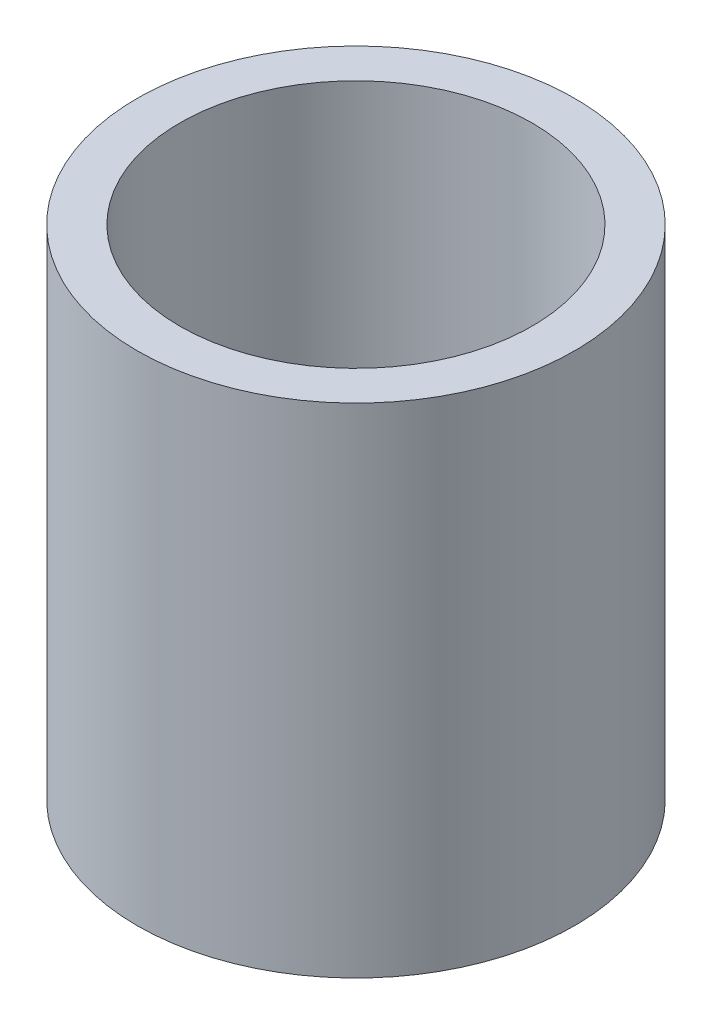
from build123d import *

# Parameters (mm, degrees)
SKETCH1_R           = 27.5
BOSS_EXTRUDE1_DEPTH = 62.610570757
SKETCH2_R           = 22.146272352
CUT_EXTRUDE1_DEPTH  = 74.706061966


with BuildPart() as part:
    # Sketch1 → Boss-Extrude1 (new body)
    with BuildSketch(Plane(origin=(0, 0, 0), x_dir=(1, 0, 0), z_dir=(0, 1, 0))):
        Circle(SKETCH1_R)
    extrude(amount=BOSS_EXTRUDE1_DEPTH)

    # Sketch2 → Cut-Extrude1 (cut, through all)
    with BuildSketch(Plane(origin=(0, 0, 0), x_dir=(1, 0, 0), z_dir=(0, 1, 0))):
        Circle(SKETCH2_R)
    extrude(amount=CUT_EXTRUDE1_DEPTH, mode=Mode.SUBTRACT)


solid = part.part
